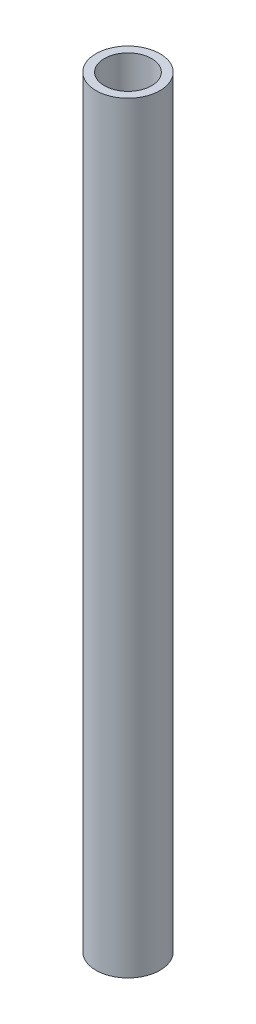
from build123d import *

# Parameters (mm, degrees)
SKETCH1_R           = 10.668
SKETCH1_R_2         = 7.874
BOSS_EXTRUDE1_DEPTH = 127


with BuildPart() as part:
    # Sketch1 → Boss-Extrude1 (new, symmetric)
    with BuildSketch(Plane(origin=(0, 0, 0), x_dir=(1, 0, 0), z_dir=(0, 1, 0))):
        Circle(SKETCH1_R)
        Circle(SKETCH1_R_2, mode=Mode.SUBTRACT)
    extrude(amount=BOSS_EXTRUDE1_DEPTH, both=True)


solid = part.part
